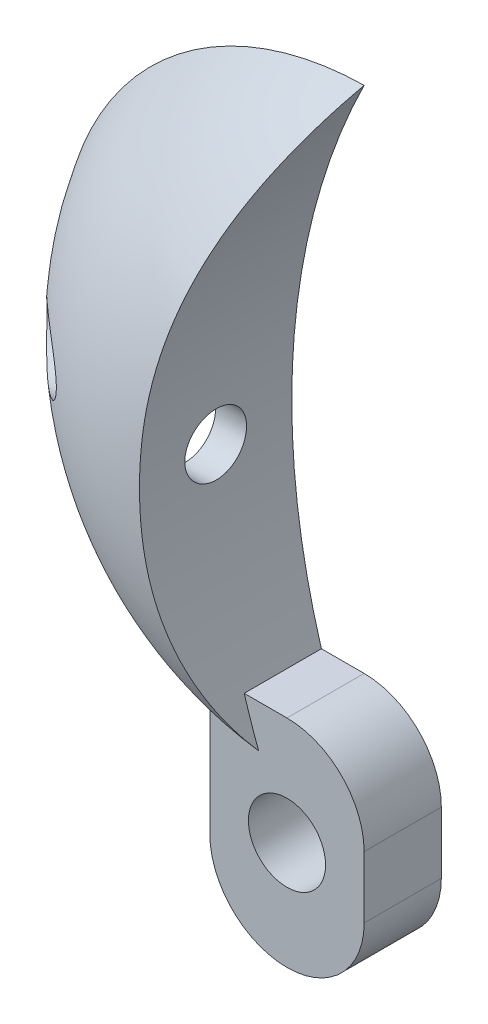
from build123d import *

# Parameters (mm, degrees)
BOSS_EXTRUDE1_DEPTH = 5
FILLET1_R           = 10
SHELL1_T            = -1
SKETCH4_R           = 1
CUT_EXTRUDE1_DEPTH  = 15.976807967
SKETCH5_W           = 5
SKETCH5_H           = 7
BOSS_EXTRUDE2_DEPTH = 2.5
SKETCH7_R           = 1.25
CUT_EXTRUDE3_DEPTH  = 17.98431764
FILLET4_R           = 2.5


# Some blends are built 0.0001 mm under size
with BuildPart() as part:
    # Sketch1 → Boss-Extrude1 (new body)
    with BuildSketch(Plane.XY):
        with BuildLine():
            ThreePointArc((-0.15625, 9.998779222), (-10, 0), (-0.15625, -9.998779222))
            ThreePointArc((-0.15625, -9.998779222), (-2.5, 0), (-0.15625, 9.998779222))
        make_face()
    extrude(amount=BOSS_EXTRUDE1_DEPTH)

    # Fillet1
    # the kernel refuses this fillet: 10 mm, written as the material it takes off along each edge
    with BuildSketch(Plane(origin=(0, 0, 5), x_dir=(0.9999950652018581, 0.003141587485880102, 0), z_dir=(0.003141587485880102, -0.9999950652018581, 0))) as fillet1_piece_1:
        with BuildLine():
            CenterArc((1.339745962, -10), FILLET1_R, 30, 60)
            Line((1.339745962, 0), (1.339745962, 0.2))
            Line((1.339745962, 0.2), (10, 0.2))
            Line((10, 0.2), (10.2, 0))
            ThreePointArc((10.2, 0), (10.2, -2.5), (10.173205081, -4.9))
            Line((10.173205081, -4.9), (10, -5))
        make_face()
    revolve(axis=Axis((0, 0, 5), (0, 0, 1)), revolution_arc=359.64, mode=Mode.SUBTRACT)

    # Shell1
    shell1_openings = [part.faces().sort_by_distance(p)[0] for p in [
        (-5.162614347, 0, 0),
    ]]
    offset(amount=SHELL1_T, openings=shell1_openings, kind=Kind.INTERSECTION)

    # Sketch4 → Cut-Extrude1 (cut, through all)
    with BuildSketch(Plane(origin=(0, 0, 0), x_dir=(0, 0, -1), z_dir=(1, 0, 0))):
        with Locations(Location((-2.466231233, 0, 0), (0, 0, 324.775001353))):
            Circle(SKETCH4_R)
    extrude(amount=-CUT_EXTRUDE1_DEPTH, mode=Mode.SUBTRACT)

    # Sketch5 → Boss-Extrude2 (add)
    with BuildSketch(Plane.XY):
        with Locations((-0.15625, -9.998779222)):
            Rectangle(SKETCH5_W, SKETCH5_H)
    extrude(amount=BOSS_EXTRUDE2_DEPTH)

    # Sketch7 → Cut-Extrude3 (cut, through all)
    with BuildSketch(Plane.XY.offset(2.5)):
        with Locations((-0.15625, -9.998779222)):
            Circle(SKETCH7_R)
    extrude(amount=-CUT_EXTRUDE3_DEPTH, mode=Mode.SUBTRACT)

    # Fillet4
    fillet4_edges = [part.edges().sort_by_distance(p)[0] for p in [
        (-2.65625, -13.498779222, 1.25),
        (2.34375, -13.498779222, 1.25),
        (2.34375, -6.498779222, 1.25),
    ]]
    fillet(fillet4_edges, radius=FILLET4_R - 0.0001)  # a hair under: the kernel refuses the full size


solid = part.part
